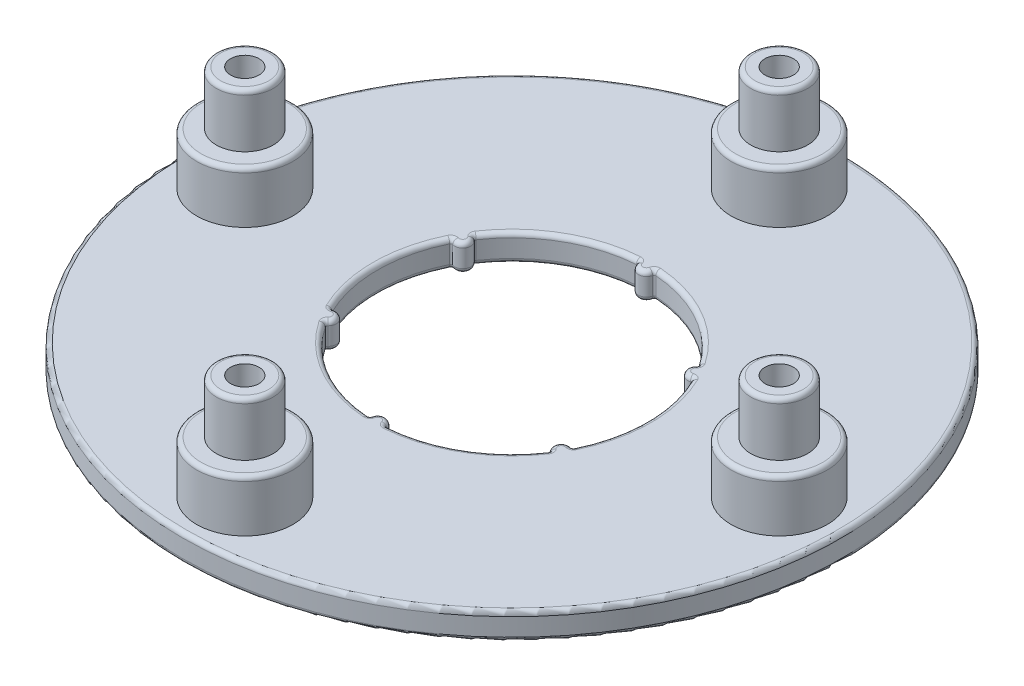
from build123d import *

# Parameters (mm, degrees)
SKETCH_1_R               = 37
EXTRUDE_1_DEPTH          = 3
CUT_EXTRUDE_1_DEPTH      = 53.411830726
SKETCH_3_R               = 5.4
EXTRUDE_2_DEPTH          = 5.8
SKETCH_4_R               = 3.2
EXTRUDE_3_DEPTH          = 6
PATTERN_CIRCULAR_1_COUNT = 4
FILLET_1_R               = 0.5
FILLET_2_R               = 0.5


# Read off the part's stored shape, not the designer's step: 高级异型孔1
with BuildPart() as part:
    # 草图1 → 凸台-拉伸1 (new body)
    with BuildSketch(Plane(origin=(0, 0, 0), x_dir=(1, 0, 0), z_dir=(0, 1, 0))):
        with Locations(Location((0, 0, 0), (0, 0, 270))):
            Circle(SKETCH_1_R)
    extrude(amount=EXTRUDE_1_DEPTH)

    # 草图2 → 切除-拉伸1 (cut, through all)
    with BuildSketch(Plane(origin=(0, 3, 0), x_dir=(1, 0, 0), z_dir=(0, 1, 0))):
        with BuildLine():
            ThreePointArc((-1.088192636, 15.060738255), (-7.55, 13.076983597), (-12.498885611, 8.472771595))
            ThreePointArc((-12.498885611, 8.472771595), (-12.53198535, 8.337332768), (-12.468545846, 8.213176826))
            ThreePointArc((-12.468545846, 8.213176826), (-12.297560734, 7.1), (-13.3470927, 6.691489038))
            ThreePointArc((-13.3470927, 6.691489038), (-13.486334652, 6.684351289), (-13.587078247, 6.58796666))
            ThreePointArc((-13.587078247, 6.58796666), (-15.1, 0), (-13.587078247, -6.58796666))
            ThreePointArc((-13.587078247, -6.58796666), (-13.486334652, -6.684351289), (-13.3470927, -6.691489038))
            ThreePointArc((-13.3470927, -6.691489038), (-12.297560734, -7.1), (-12.468545846, -8.213176826))
            ThreePointArc((-12.468545846, -8.213176826), (-12.53198535, -8.337332768), (-12.498885611, -8.472771595))
            ThreePointArc((-12.498885611, -8.472771595), (-7.55, -13.076983597), (-1.088192636, -15.060738255))
            ThreePointArc((-1.088192636, -15.060738255), (-0.954349302, -15.021684057), (-0.878546854, -14.904665864))
            ThreePointArc((-0.878546854, -14.904665864), (0, -14.2), (0.878546854, -14.904665864))
            ThreePointArc((0.878546854, -14.904665864), (0.954349302, -15.021684057), (1.088192636, -15.060738255))
            ThreePointArc((1.088192636, -15.060738255), (7.55, -13.076983597), (12.498885611, -8.472771595))
            ThreePointArc((12.498885611, -8.472771595), (12.53198535, -8.337332768), (12.468545846, -8.213176826))
            ThreePointArc((12.468545846, -8.213176826), (12.297560734, -7.1), (13.3470927, -6.691489038))
            ThreePointArc((13.3470927, -6.691489038), (13.486334652, -6.684351289), (13.587078247, -6.58796666))
            ThreePointArc((13.587078247, -6.58796666), (15.1, 0), (13.587078247, 6.58796666))
            ThreePointArc((13.587078247, 6.58796666), (13.486334652, 6.684351289), (13.3470927, 6.691489038))
            ThreePointArc((13.3470927, 6.691489038), (12.297560734, 7.1), (12.468545846, 8.213176826))
            ThreePointArc((12.468545846, 8.213176826), (12.53198535, 8.337332768), (12.498885611, 8.472771595))
            ThreePointArc((12.498885611, 8.472771595), (7.55, 13.076983597), (1.088192636, 15.060738255))
            ThreePointArc((1.088192636, 15.060738255), (0.954349302, 15.021684057), (0.878546854, 14.904665864))
            ThreePointArc((0.878546854, 14.904665864), (0, 14.2), (-0.878546854, 14.904665864))
            ThreePointArc((-0.878546854, 14.904665864), (-0.954349302, 15.021684057), (-1.088192636, 15.060738255))
        make_face()
    extrude(amount=-CUT_EXTRUDE_1_DEPTH, mode=Mode.SUBTRACT)

    # 草图3 → 凸台-拉伸2 (add)
    with BuildSketch(Plane(origin=(0, 3, 0), x_dir=(1, 0, 0), z_dir=(0, 1, 0))):
        with Locations(Location((0, 30, 0), (0, 0, 270))):
            Circle(SKETCH_3_R)
        with Locations(Location((30, 0, 0), (0, 0, 270))):
            Circle(SKETCH_3_R)
        with Locations(Location((0, -30, 0), (0, 0, 270))):
            Circle(SKETCH_3_R)
        with Locations(Location((-30, 0, 0), (0, 0, 270))):
            Circle(SKETCH_3_R)
    extrude(amount=EXTRUDE_2_DEPTH)

    # 草图4 → 凸台-拉伸3 (add)
    with BuildSketch(Plane(origin=(0, 8.8, 0), x_dir=(1, 0, 0), z_dir=(0, 1, 0))):
        with Locations(Location((0, 30, 0), (0, 0, 270))):
            Circle(SKETCH_4_R)
        with Locations(Location((30, 0, 0), (0, 0, 270))):
            Circle(SKETCH_4_R)
        with Locations(Location((0, -30, 0), (0, 0, 270))):
            Circle(SKETCH_4_R)
        with Locations(Location((-30, 0, 0), (0, 0, 270))):
            Circle(SKETCH_4_R)
    extrude(amount=EXTRUDE_3_DEPTH)

    # 高级异型孔1 outline → 高级异型孔1 (revolve, cut)
    with BuildSketch(Plane.XY.offset(30)):
        Polygon((0, 0), (3.3, 0), (1.6, 1.7), (1.6, 14.8), (0, 14.8), align=None)
    other_1 = revolve(axis=Axis((0, 0, 30), (0, 1, 0)), mode=Mode.SUBTRACT)

    # 阵列(圆周)1: 高级异型孔1 ×4 about axis
    pattern_circular_1_axis = Axis((0, 0, 0), (0, 1, 0))
    for i in range(1, PATTERN_CIRCULAR_1_COUNT):
        add(other_1.rotate(pattern_circular_1_axis, i * 360 / PATTERN_CIRCULAR_1_COUNT), mode=Mode.SUBTRACT)

    # 圆角1
    fillet_1_edges = [part.edges().sort_by_distance(p)[0] for p in [
        (0.954349302, 0, -15.021684057),
        (7.55, 0, -13.076983597),
        (12.53198535, 0, -8.337332768),
        (12.297560734, 0, -7.1),
        (13.486334652, 0, -6.684351289),
        (15.1, 0, 0),
        (13.486334652, 0, 6.684351289),
        (12.297560734, 0, 7.1),
        (12.53198535, 0, 8.337332768),
        (7.55, 0, 13.076983597),
        (0.954349302, 0, 15.021684057),
        (0, 0, 14.2),
        (-0.954349302, 0, 15.021684057),
        (-7.55, 0, 13.076983597),
        (-12.53198535, 0, 8.337332768),
        (-12.297560734, 0, 7.1),
        (-13.486334652, 0, 6.684351289),
        (-15.1, 0, 0),
        (-13.486334652, 0, -6.684351289),
        (-12.297560734, 0, -7.1),
        (-12.53198535, 0, -8.337332768),
        (-7.55, 0, -13.076983597),
        (-0.954349302, 0, -15.021684057),
        (0, 0, -14.2),
        (0.954349302, 3, -15.021684057),
        (0, 3, -14.2),
        (-0.954349302, 3, -15.021684057),
        (-7.55, 3, -13.076983597),
        (-12.53198535, 3, -8.337332768),
        (-12.297560734, 3, -7.1),
        (-13.486334652, 3, -6.684351289),
        (-15.1, 3, 0),
        (-13.486334652, 3, 6.684351289),
        (-12.297560734, 3, 7.1),
        (-12.53198535, 3, 8.337332768),
        (-7.55, 3, 13.076983597),
        (-0.954349302, 3, 15.021684057),
        (0, 3, 14.2),
        (0.954349302, 3, 15.021684057),
        (7.55, 3, 13.076983597),
        (12.53198535, 3, 8.337332768),
        (12.297560734, 3, 7.1),
        (13.486334652, 3, 6.684351289),
        (15.1, 3, 0),
        (13.486334652, 3, -6.684351289),
        (12.297560734, 3, -7.1),
        (12.53198535, 3, -8.337332768),
        (7.55, 3, -13.076983597),
    ]]
    fillet(fillet_1_edges, radius=FILLET_1_R)

    # 圆角2
    fillet_2_edges = [part.edges().sort_by_distance(p)[0] for p in [
        (0, 14.8, -33.2),
        (30, 14.8, -3.2),
        (0, 14.8, 26.8),
        (-30, 14.8, -3.2),
        (0, 0, -37),
        (0, 3, -37),
        (0, 8.8, -35.4),
        (30, 8.8, -5.4),
        (0, 8.8, 24.6),
        (-30, 8.8, -5.4),
    ]]
    fillet(fillet_2_edges, radius=FILLET_2_R)


solid = part.part
